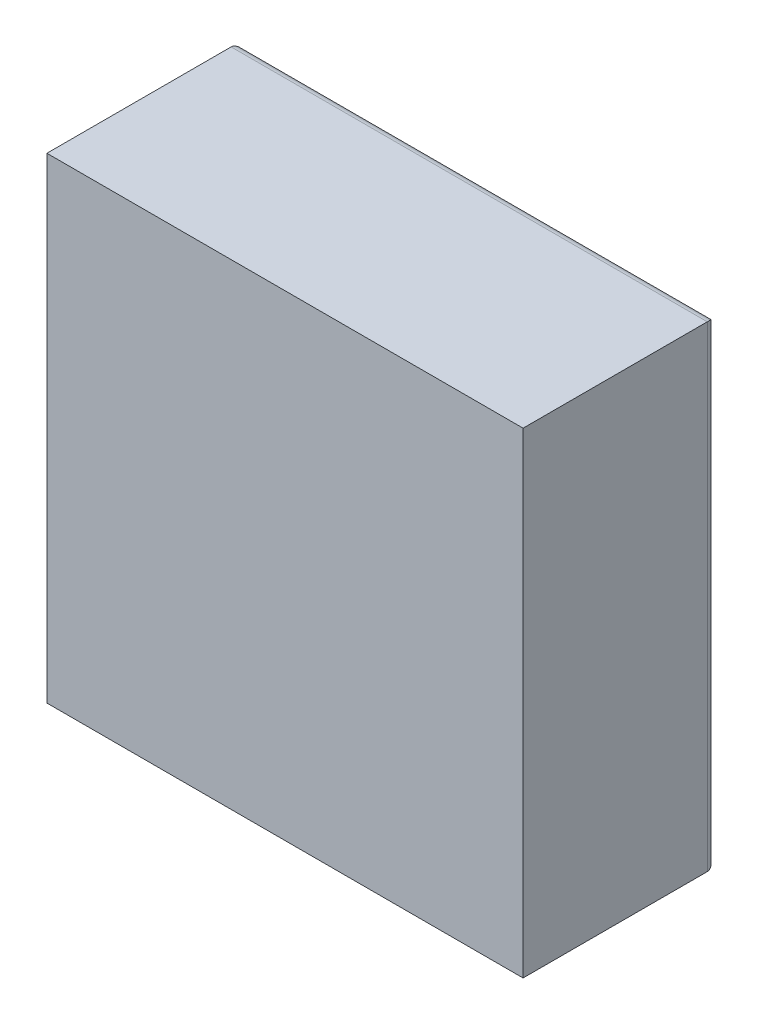
from build123d import *

# Parameters (mm, degrees)
SKETCH1_W           = 504
SKETCH1_H           = 504
BOSS_EXTRUDE1_DEPTH = 205
SKETCH2_W           = 500
SKETCH2_H           = 500
CUT_EXTRUDE1_DEPTH  = 200
FILLET2_R           = 10
FILLET4_R           = 10


with BuildPart() as part:
    # Sketch1 → Boss-Extrude1 (new body)
    with BuildSketch(Plane.XY):
        Rectangle(SKETCH1_W, SKETCH1_H)
    extrude(amount=BOSS_EXTRUDE1_DEPTH)

    # Sketch2 → Cut-Extrude1 (cut)
    with BuildSketch(Plane(origin=(0, 0, 0), x_dir=(-1, 0, 0), z_dir=(0, 0, -1))):
        Rectangle(SKETCH2_W, SKETCH2_H)
    extrude(amount=-CUT_EXTRUDE1_DEPTH, mode=Mode.SUBTRACT)

    # Fillet2
    # the kernel refuses this fillet: 10 mm, written as the material it adds along each edge
    with BuildSketch(Plane(origin=(-250, -250, 0), x_dir=(0, 1, 0), z_dir=(0, 0, 1))) as fillet2_piece_1:
        with BuildLine():
            CenterArc((FILLET2_R, -FILLET2_R), FILLET2_R, 90, 90)
            Line((0, -FILLET2_R), (0, 0))
            Line((0, 0), (FILLET2_R, 0))
        make_face()
    extrude(amount=200)
    # the kernel refuses this fillet: 10 mm, written as the material it takes off along each edge
    with BuildSketch(Plane(origin=(-277, -252, 0), x_dir=(0, 1, 0), z_dir=(1, 0, 0))) as fillet2_2_piece_1:
        with BuildLine():
            CenterArc((FILLET2_R, FILLET2_R), FILLET2_R, 180, 90)
            Line((0, FILLET2_R), (0, 0))
            Line((0, 0), (FILLET2_R, 0))
        make_face()
    extrude(amount=554, mode=Mode.SUBTRACT)
    with BuildSketch(Plane(origin=(252, -277, 0), x_dir=(0, 0, 1), z_dir=(0, 1, 0)), Plane(origin=(277, 252, 0), x_dir=(0, 0, 1), z_dir=(-1, 0, 0)), Plane(origin=(-252, 277, 0), x_dir=(0, 0, 1), z_dir=(0, -1, 0))) as fillet2_2_piece_2:
        with BuildLine():
            CenterArc((FILLET2_R, -FILLET2_R), FILLET2_R, 90, 90)
            Line((0, -FILLET2_R), (0, 0))
            Line((0, 0), (FILLET2_R, 0))
        make_face()
    extrude(amount=554, mode=Mode.SUBTRACT)

    # Fillet4
    fillet4_edges = [part.edges().sort_by_distance(p)[0] for p in [
        (5, -250, 200),
        (250, 0, 200),
        (0, 250, 200),
        (-250, 5, 200),
        (-247.071067812, -247.071067812, 200),
    ]]
    fillet(fillet4_edges, radius=FILLET4_R)


solid = part.part
